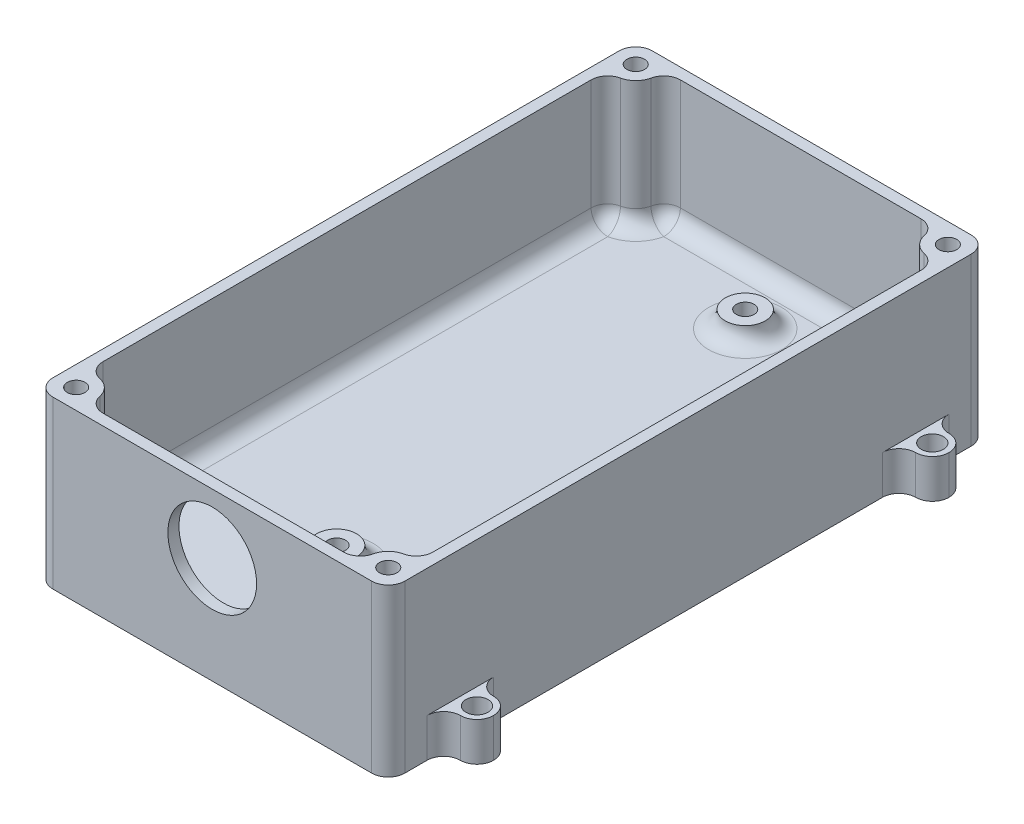
from build123d import *

# Parameters (mm, degrees)
SKETCH1_R          = 2
BASE_DEPTH         = 7
WALLS_START        = 7
SKETCH1_3_R        = 1.6
WALLS_DEPTH        = 23
STANDOFFS_START    = 7
SKETCH1_4_R        = 3.6
SKETCH1_4_R_2      = 1.6
STANDOFFS_DEPTH    = 3
INTERNAL_FILLET_R  = 3
EXTERNAL_FILLET_R  = 3
SKETCH2_R          = 8
CUT_EXTRUDE1_DEPTH = 2


with BuildPart() as part:
    # Sketch1 → BASE (new body)
    with BuildSketch(Plane(origin=(0, 0, 0), x_dir=(1, 0, 0), z_dir=(0, 1, 0))):
        Polygon((-31.75, -38.07), (-37.75, -38.07), (-37.75, -44.07), (-31.75, -44.07), (-31.75, -54.07), (31.75, -54.07), (31.75, -44.07), (37.75, -44.07), (37.75, -38.07), (31.75, -38.07), (31.75, 38.07), (37.75, 38.07), (37.75, 44.07), (31.75, 44.07), (31.75, 54.07), (-31.75, 54.07), (-31.75, 44.07), (-37.75, 44.07), (-37.75, 38.07), (-31.75, 38.07), align=None)
        with Locations(Location((-34.75, -41.07, 0), (0, 0, 270))):
            Circle(SKETCH1_R, mode=Mode.SUBTRACT)
        with Locations(Location((-34.75, 41.07, 0), (0, 0, 270))):
            Circle(SKETCH1_R, mode=Mode.SUBTRACT)
        with Locations(Location((34.75, -41.07, 0), (0, 0, 270))):
            Circle(SKETCH1_R, mode=Mode.SUBTRACT)
        with Locations(Location((34.75, 41.07, 0), (0, 0, 270))):
            Circle(SKETCH1_R, mode=Mode.SUBTRACT)
    extrude(amount=BASE_DEPTH)

    # Sketch1<3> → Walls (add)
    with BuildSketch(Plane(origin=(0, 0, 0), x_dir=(1, 0, 0), z_dir=(0, 1, 0)).offset(WALLS_START)):
        Polygon((-31.75, 38.07), (-31.75, -38.07), (-31.75, -44.07), (-31.75, -54.07), (31.75, -54.07), (31.75, -44.07), (31.75, -38.07), (31.75, 38.07), (31.75, 44.07), (31.75, 54.07), (-31.75, 54.07), (-31.75, 44.07), align=None)
        with Locations(Location((-28.15, -50.47, 0), (0, 0, 270))):
            Circle(SKETCH1_3_R, mode=Mode.SUBTRACT)
        with BuildLine():
            Line((24.925096901, -52.07), (-24.925096901, -52.07))
            ThreePointArc((-24.925096901, -52.07), (-25.604415588, -47.924415588), (-29.75, -47.245096901))
            Line((-29.75, -47.245096901), (-29.75, 47.245096901))
            ThreePointArc((-29.75, 47.245096901), (-25.604415588, 47.924415588), (-24.925096901, 52.07))
            Line((-24.925096901, 52.07), (24.925096901, 52.07))
            ThreePointArc((24.925096901, 52.07), (25.604415588, 47.924415588), (29.75, 47.245096901))
            Line((29.75, 47.245096901), (29.75, -47.245096901))
            ThreePointArc((29.75, -47.245096901), (25.604415588, -47.924415588), (24.925096901, -52.07))
        make_face(mode=Mode.SUBTRACT)
        with Locations(Location((28.15, -50.47, 0), (0, 0, 270))):
            Circle(SKETCH1_3_R, mode=Mode.SUBTRACT)
        with Locations(Location((-28.15, 50.47, 0), (0, 0, 270))):
            Circle(SKETCH1_3_R, mode=Mode.SUBTRACT)
        with Locations(Location((28.15, 50.47, 0), (0, 0, 270))):
            Circle(SKETCH1_3_R, mode=Mode.SUBTRACT)
    extrude(amount=WALLS_DEPTH)

    # Sketch1<4> → Standoffs (add)
    # profile 1 of 2: a face of its own
    with BuildSketch(Plane(origin=(0, 0, 0), x_dir=(1, 0, 0), z_dir=(0, 1, 0)).offset(STANDOFFS_START)):
        with Locations(Location((0, 42.07, 0), (0, 0, 270))):
            Circle(SKETCH1_4_R)
        with Locations(Location((0, 42.07, 0), (0, 0, 270))):
            Circle(SKETCH1_4_R_2, mode=Mode.SUBTRACT)
    # profile 2 of 2: a face of its own
    with BuildSketch(Plane(origin=(0, 0, 0), x_dir=(1, 0, 0), z_dir=(0, 1, 0)).offset(STANDOFFS_START)):
        with Locations(Location((0, -31.63, 0), (0, 0, 270))):
            Circle(SKETCH1_4_R)
        with Locations(Location((0, -31.63, 0), (0, 0, 270))):
            Circle(SKETCH1_4_R_2, mode=Mode.SUBTRACT)
    extrude(amount=STANDOFFS_DEPTH)

    # Internal Fillet
    internal_fillet_edges = [part.edges().sort_by_distance(p)[0] for p in [
        (-29.75, 18.5, 47.245096901),
        (-25.604415588, 7, 47.924415588),
        (-24.925096901, 18.5, 52.07),
        (0, 7, 52.07),
        (24.925096901, 18.5, 52.07),
        (25.604415588, 7, 47.924415588),
        (29.75, 18.5, 47.245096901),
        (29.75, 7, 0),
        (29.75, 18.5, -47.245096901),
        (25.604415588, 7, -47.924415588),
        (24.925096901, 18.5, -52.07),
        (-24.925096901, 18.5, -52.07),
        (-25.604415588, 7, -47.924415588),
        (-29.75, 18.5, -47.245096901),
        (0, 7, -45.67),
        (0, 7, 28.03),
        (-29.75, 7, 0),
        (0, 7, -52.07),
    ]]
    fillet(internal_fillet_edges, radius=INTERNAL_FILLET_R - 0.0001)  # a hair under: the kernel refuses the full size

    # External Fillet
    external_fillet_edges = [part.edges().sort_by_distance(p)[0] for p in [
        (-31.75, 15, 54.07),
        (-31.75, 15, -54.07),
        (31.75, 15, -54.07),
        (31.75, 15, 54.07),
        (31.75, 3.5, 38.07),
        (37.75, 3.5, 38.07),
        (37.75, 3.5, 44.07),
        (31.75, 3.5, 44.07),
        (31.75, 3.5, -38.07),
        (31.75, 3.5, -44.07),
        (37.75, 3.5, -38.07),
        (37.75, 3.5, -44.07),
        (-31.75, 3.5, -38.07),
        (-37.75, 3.5, -38.07),
        (-37.75, 3.5, -44.07),
        (-31.75, 3.5, -44.07),
        (-31.75, 3.5, 38.07),
        (-37.75, 3.5, 38.07),
        (-37.75, 3.5, 44.07),
        (-31.75, 3.5, 44.07),
    ]]
    fillet(external_fillet_edges, radius=EXTERNAL_FILLET_R - 0.0001)  # a hair under: the kernel refuses the full size

    # Sketch2 → Cut-Extrude1 (cut)
    with BuildSketch(Plane(origin=(27.4, 0, 54.07), x_dir=(-1, 0, 0), z_dir=(0, 0, -1))):
        with Locations(Location((27.4, 19.200000012, 0), (0, 0, 180))):
            Circle(SKETCH2_R)
    extrude(amount=CUT_EXTRUDE1_DEPTH, mode=Mode.SUBTRACT)


solid = part.part
